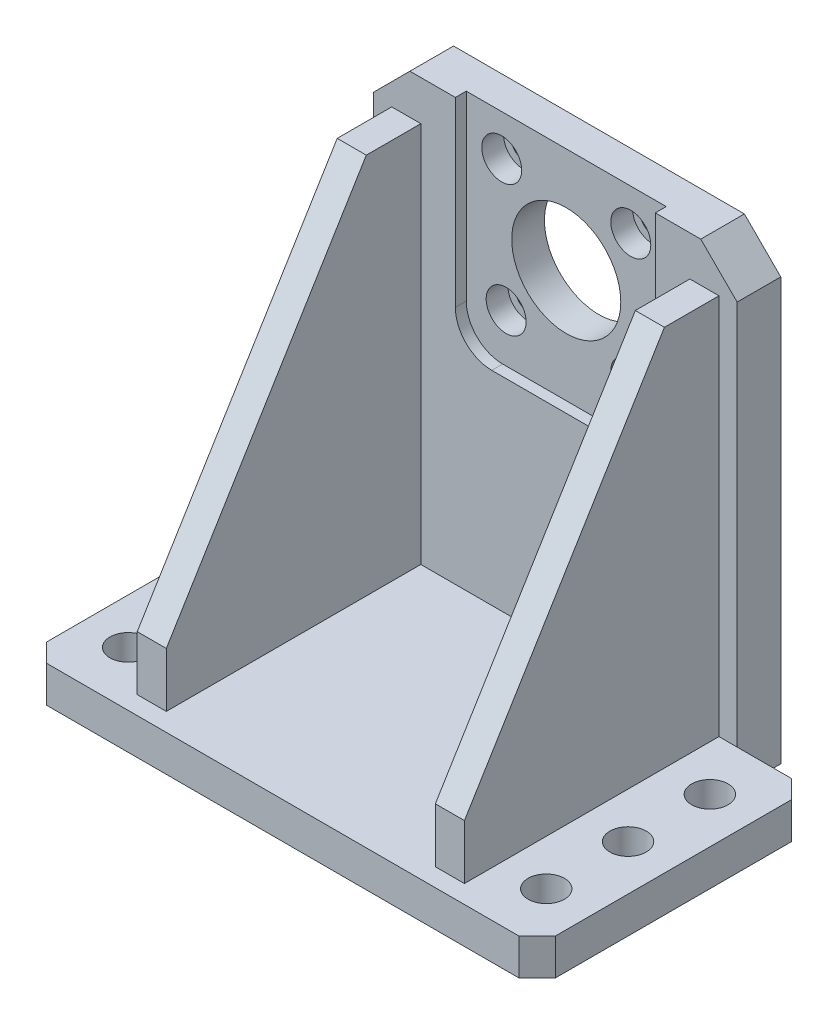
from build123d import *

# Parameters (mm, degrees)
SKETCH1_W                                    = 140
SKETCH1_H                                    = 75
BOSS_EXTRUDE1_DEPTH                          = 10
SKETCH2_W                                    = 100
SKETCH2_H                                    = 12
BOSS_EXTRUDE2_DEPTH                          = 126
GUSSET1_START                                = 25
GUSSET1_DEPTH                                = 8
GUSSET2_START                                = 107
GUSSET2_DEPTH                                = 8
F_10_0MM_DOWEL_HOLE1_AT_2_COUNT              = 2
F_10_0MM_DOWEL_HOLE1_AT_2_PITCH              = 115
F_10_0MM_DOWEL_HOLE2_AT_2_COUNT              = 2
F_10_0MM_DOWEL_HOLE2_AT_2_PITCH              = 45
F_10_0MM_DOWEL_HOLE2_AT_3_COUNT              = 2
F_10_0MM_DOWEL_HOLE2_AT_3_PITCH              = 115
F_10_0MM_DOWEL_HOLE2_AT_4_COUNT              = 2
F_10_0MM_DOWEL_HOLE2_AT_4_PITCH              = 123.490890352
CUT_EXTRUDE1_DEPTH                           = 3
SKETCH15_R                                   = 15
CUT_EXTRUDE2_DEPTH                           = 204.862698893
CBORE_FOR_M5_HEX_SOCKET_HEAD_CAP_SCR_2_COUNT = 2
CBORE_FOR_M5_HEX_SOCKET_HEAD_CAP_SCR_2_PITCH = 35.5
CBORE_FOR_M5_HEX_SOCKET_HEAD_CAP_SCR_3_COUNT = 2
CBORE_FOR_M5_HEX_SOCKET_HEAD_CAP_SCR_3_PITCH = 50.204581464
CBORE_FOR_M5_HEX_SOCKET_HEAD_CAP_SCR_4_COUNT = 2
CBORE_FOR_M5_HEX_SOCKET_HEAD_CAP_SCR_4_PITCH = 35.520758797
CHAMFER1_SIZE                                = 5
CHAMFER2_SIZE                                = 10


# Read off the part's stored shape, not the designer's step: Gusset1, Gusset2
with BuildPart() as part:
    # Sketch1 → Boss-Extrude1 (new body)
    with BuildSketch(Plane(origin=(0, 0, 0), x_dir=(1, 0, 0), z_dir=(0, 1, 0))):
        with Locations((70, 37.5)):
            Rectangle(SKETCH1_W, SKETCH1_H)
    extrude(amount=BOSS_EXTRUDE1_DEPTH)

    # Sketch2 → Boss-Extrude2 (add)
    with BuildSketch(Plane(origin=(0, 0, 0), x_dir=(1, 0, 0), z_dir=(0, 1, 0))):
        with Locations((70, 81)):
            Rectangle(SKETCH2_W, SKETCH2_H)
    extrude(amount=BOSS_EXTRUDE2_DEPTH)

    # Sketch7 → Ø10.0mm Dowel Hole1 (revolve, cut)
    with BuildSketch(Plane(origin=(12.5, 10, -37.5), x_dir=(0, 0, 1), z_dir=(1, 0, 0))):
        Polygon((0, 0), (0, 19.004303095), (5, 16), (5, 0), align=None)
    f_10_0mm_dowel_hole1 = revolve(axis=Axis((12.5, 16.35, -37.5), (0, -1, 0)), mode=Mode.SUBTRACT)

    # Ø10.0mm Dowel Hole1 at 2: Ø10.0mm Dowel Hole1 ×2
    with Locations(*[(i * F_10_0MM_DOWEL_HOLE1_AT_2_PITCH, 0, 0) for i in range(1, F_10_0MM_DOWEL_HOLE1_AT_2_COUNT)]):
        add(f_10_0mm_dowel_hole1, mode=Mode.SUBTRACT)

    # Sketch13 → Ø10.0mm Dowel Hole2 (revolve, cut)
    with BuildSketch(Plane(origin=(12.5, 10, -60), x_dir=(0, 0, 1), z_dir=(1, 0, 0))):
        Polygon((0, 0), (0, 32.254303095), (5, 29.25), (5, 0), align=None)
    f_10_0mm_dowel_hole2 = revolve(axis=Axis((12.5, 16.35, -60), (0, -1, 0)), mode=Mode.SUBTRACT)

    # Ø10.0mm Dowel Hole2 at 2: Ø10.0mm Dowel Hole2 ×2
    with Locations(*[(0, 0, i * F_10_0MM_DOWEL_HOLE2_AT_2_PITCH) for i in range(1, F_10_0MM_DOWEL_HOLE2_AT_2_COUNT)]):
        add(f_10_0mm_dowel_hole2, mode=Mode.SUBTRACT)

    # Ø10.0mm Dowel Hole2 at 3: Ø10.0mm Dowel Hole2 ×2
    with Locations(*[(i * F_10_0MM_DOWEL_HOLE2_AT_3_PITCH, 0, 0) for i in range(1, F_10_0MM_DOWEL_HOLE2_AT_3_COUNT)]):
        add(f_10_0mm_dowel_hole2, mode=Mode.SUBTRACT)

    # Ø10.0mm Dowel Hole2 at 4: Ø10.0mm Dowel Hole2 ×2
    with Locations(*[Vector(0.9312427797057534, 0, 0.3643993485805122) * (i * F_10_0MM_DOWEL_HOLE2_AT_4_PITCH) for i in range(1, F_10_0MM_DOWEL_HOLE2_AT_4_COUNT)]):
        add(f_10_0mm_dowel_hole2, mode=Mode.SUBTRACT)

    # Sketch14 → Cut-Extrude1 (cut)
    with BuildSketch(Plane.XY.offset(-75)):
        with BuildLine():
            Line((42.5, 126), (97.5, 126))
            Line((97.5, 126), (97.5, 76))
            ThreePointArc((97.5, 76), (94.571067812, 68.928932188), (87.5, 66))
            Line((87.5, 66), (52.5, 66))
            ThreePointArc((52.5, 66), (45.428932188, 68.928932188), (42.5, 76))
            Line((42.5, 76), (42.5, 126))
        make_face()
    extrude(amount=-CUT_EXTRUDE1_DEPTH, mode=Mode.SUBTRACT)

    # Sketch15 → Cut-Extrude2 (cut, through all)
    with BuildSketch(Plane.XY.offset(-78)):
        with Locations((70, 97)):
            Circle(SKETCH15_R)
    extrude(amount=-CUT_EXTRUDE2_DEPTH, mode=Mode.SUBTRACT)

    # Sketch20 → CBORE for M5 Hex Socket Head Cap Screw1 (revolve, cut)
    with BuildSketch(Plane(origin=(52.25, 114.75, -78), x_dir=(0, -1, 0), z_dir=(1, 0, 0))):
        Polygon((0, 0), (0, 9), (3.3, 9), (3.3, 6), (5.5, 6), (5.5, 0), align=None)
    cbore_for_m5_hex_socket_head_cap_screw1 = revolve(axis=Axis((52.25, 114.75, -71.65), (0, 0, -1)), mode=Mode.SUBTRACT)

    # CBORE for M5 Hex Socket Head Cap Scr 2: CBORE for M5 Hex Socket Head Cap Screw1 ×2
    with Locations(*[(i * CBORE_FOR_M5_HEX_SOCKET_HEAD_CAP_SCR_2_PITCH, 0, 0) for i in range(1, CBORE_FOR_M5_HEX_SOCKET_HEAD_CAP_SCR_2_COUNT)]):
        add(cbore_for_m5_hex_socket_head_cap_screw1, mode=Mode.SUBTRACT)

    # CBORE for M5 Hex Socket Head Cap Scr 3: CBORE for M5 Hex Socket Head Cap Screw1 ×2
    with Locations(*[Vector(0.7071067811865476, -0.7071067811865475, 0) * (i * CBORE_FOR_M5_HEX_SOCKET_HEAD_CAP_SCR_3_PITCH) for i in range(1, CBORE_FOR_M5_HEX_SOCKET_HEAD_CAP_SCR_3_COUNT)]):
        add(cbore_for_m5_hex_socket_head_cap_screw1, mode=Mode.SUBTRACT)

    # CBORE for M5 Hex Socket Head Cap Scr 4: CBORE for M5 Hex Socket Head Cap Screw1 ×2
    with Locations(*[Vector(0.034183104868825386, -0.9994155869014286, 0) * (i * CBORE_FOR_M5_HEX_SOCKET_HEAD_CAP_SCR_4_PITCH) for i in range(1, CBORE_FOR_M5_HEX_SOCKET_HEAD_CAP_SCR_4_COUNT)]):
        add(cbore_for_m5_hex_socket_head_cap_screw1, mode=Mode.SUBTRACT)

    # Chamfer1
    chamfer1_edges = [part.edges().sort_by_distance(p)[0] for p in [
        (0, 5, -75),
        (140, 5, -75),
        (140, 5, 0),
        (0, 5, 0),
    ]]
    chamfer(chamfer1_edges, length=CHAMFER1_SIZE)

    # Chamfer2
    chamfer2_edges = [part.edges().sort_by_distance(p)[0] for p in [
        (20, 126, -81),
        (120, 126, -81),
    ]]
    chamfer(chamfer2_edges, length=CHAMFER2_SIZE)


with BuildPart() as body_2:
    # Gusset1 outline → Gusset1 (new body)
    with BuildSketch(Plane.YZ.offset(GUSSET1_START)):
        Polygon((115, -75), (115, -60), (25, -5), (10, -5), (10, -75), align=None)
    extrude(amount=GUSSET1_DEPTH)


with BuildPart() as body_3:
    # Gusset2 outline → Gusset2 (new body)
    with BuildSketch(Plane.YZ.offset(GUSSET2_START)):
        Polygon((115, -75), (115, -60), (25, -5), (10, -5), (10, -75), align=None)
    extrude(amount=GUSSET2_DEPTH)


solid = Compound([part.part, body_2.part, body_3.part])
